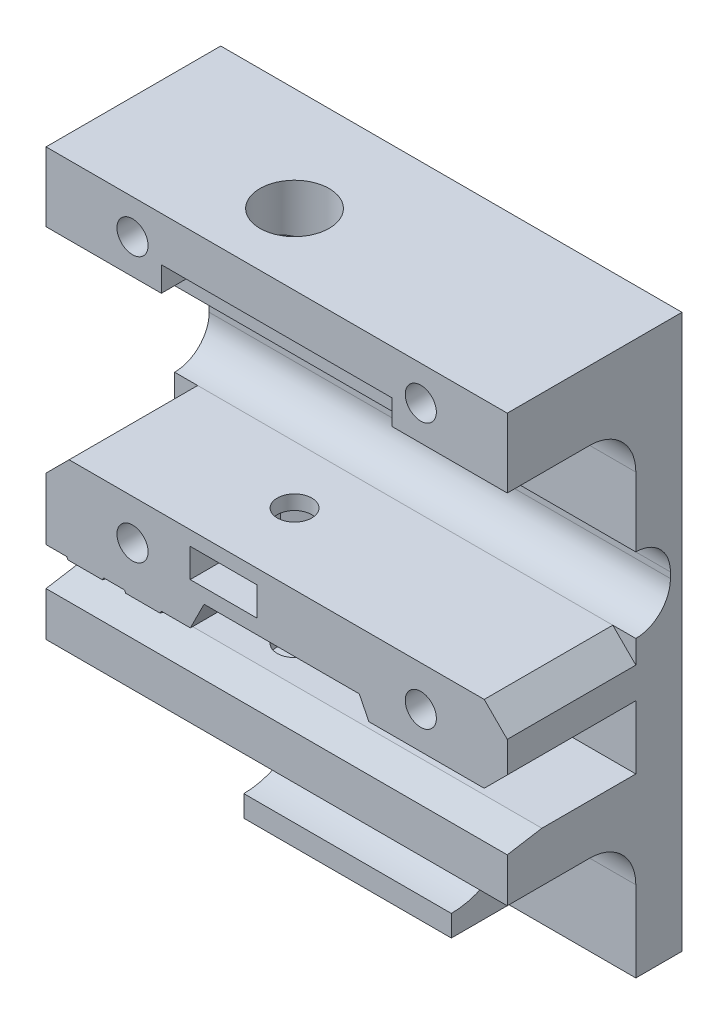
from build123d import *
from OCP.BRepFilletAPI import BRepFilletAPI_MakeChamfer

# Parameters (mm, degrees)
SKETCH1_W                = 40
SKETCH1_H                = 48
BOSS_EXTRUDE1_DEPTH      = 4
BOSS_EXTRUDE2_DEPTH      = 11.15
BOSS_EXTRUDE2_DEPTH_BACK = 4
SKETCH5_W                = 40
SKETCH5_H                = 4.325
SKETCH5_W_2              = 18
SKETCH5_H_2              = 5
SKETCH5_H_3              = 6
FILLET1_R                = 4
SKETCH6_R                = 1.35
CUT_EXTRUDE4_DEPTH       = 58.214705278
CHAMFER2_SIZE            = 2
SKETCH7_W                = 40
SKETCH7_H                = 6.5
CUT_EXTRUDE5_DEPTH       = 3
FILLET2_R                = 3
CHAMFER3_SIZE            = 3
CHAMFER3_SIZE2           = 1
CHAMFER4_SIZE            = 3
CHAMFER4_SIZE2           = 0.5
CUT_EXTRUDE6_DEPTH       = 10
CUT_EXTRUDE6_DEPTH_BACK  = 10
CUT_EXTRUDE8_REACH       = 66.292
SKETCH12_R               = 3
SKETCH13_R               = 1.5
CUT_EXTRUDE10_DEPTH      = 11.175
CUT_EXTRUDE7_DEPTH       = 1.25
CUT_EXTRUDE7_DEPTH_BACK  = 1.25


with BuildPart() as part:
    # Sketch1 → Boss-Extrude1 (new body)
    with BuildSketch(Plane.XY):
        with Locations((20, 14)):
            Rectangle(SKETCH1_W, SKETCH1_H)
    extrude(amount=BOSS_EXTRUDE1_DEPTH)

    # Sketch5 → Boss-Extrude2 (add, two sides: drawn at the far end of the back side and taken through both)
    with BuildSketch(Plane.XY.offset(4).offset(-BOSS_EXTRUDE2_DEPTH_BACK)):
        Polygon((1.8, 8.125), (0, 8.125), (0, 15.5), (40, 15.5), (40, 8.825), (28, 8.825), (27.1625, 10.5), (13.70350416, 10.5), (12.51600416, 8.125), (10, 8.125), (9.4, 6.925), (7.4, 6.925), (6.8, 8.125), (5, 8.125), (4.4, 6.925), (2.4, 6.925), align=None)
        with Locations((20, 3.1625)):
            Rectangle(SKETCH5_W, SKETCH5_H)
        with Locations((20, -7.5)):
            Rectangle(SKETCH5_W_2, SKETCH5_H_2)
        with Locations((20, 35)):
            Rectangle(SKETCH5_W, SKETCH5_H_3)
    extrude(amount=BOSS_EXTRUDE2_DEPTH + BOSS_EXTRUDE2_DEPTH_BACK)

    # Fillet1
    fillet1_edges = [part.edges().sort_by_distance(p)[0] for p in [
        (20, 32, 4),
        (20, 1, 4),
    ]]
    fillet(fillet1_edges, radius=FILLET1_R)

    # Sketch6 → Cut-Extrude4 (cut, through all)
    with BuildSketch(Plane.XY.offset(15.15)):
        with Locations((7.5, 35)):
            Circle(SKETCH6_R)
        with Locations((7.5, 12)):
            Circle(SKETCH6_R)
        with Locations((32.5, 35)):
            Circle(SKETCH6_R)
        with Locations((32.5, 12)):
            Circle(SKETCH6_R)
    extrude(amount=-CUT_EXTRUDE4_DEPTH, mode=Mode.SUBTRACT)

    # Chamfer2
    chamfer2_edges = [part.edges().sort_by_distance(p)[0] for p in [
        (40, 8.825, 9.575),
        (0, 15.5, 9.575),
        (40, 15.5, 9.575),
    ]]
    chamfer(chamfer2_edges, length=CHAMFER2_SIZE)

    # Sketch7 → Cut-Extrude5 (cut)
    with BuildSketch(Plane.XY.offset(4)):
        with Locations((20, 18.75)):
            Rectangle(SKETCH7_W, SKETCH7_H)
    extrude(amount=-CUT_EXTRUDE5_DEPTH, mode=Mode.SUBTRACT)

    # Fillet2
    fillet2_edges = [part.edges().sort_by_distance(p)[0] for p in [
        (20, 15.5, 1),
        (20, 22, 1),
    ]]
    fillet(fillet2_edges, radius=FILLET2_R - 0.0001)  # a hair under: the kernel refuses the full size

    # Chamfer3: one chamfer whose edges measure the first distance from different faces: ONE call of the kernel's chamfer builder (chamfer() names one face for all edges)
    chamfer3_edges_1 = [part.edges().sort_by_distance(p)[0] for p in [
        (3.4, 6.925, 15.15),
    ]]
    chamfer3_side_1 = [part.faces().sort_by_distance(p)[0] for p in [
        (3.4, 6.925, 9.575),
    ]]
    chamfer3_edges_2 = [part.edges().sort_by_distance(p)[0] for p in [
        (8.4, 6.925, 15.15),
    ]]
    chamfer3_side_2 = [part.faces().sort_by_distance(p)[0] for p in [
        (8.4, 6.925, 9.575),
    ]]
    chamfer3 = BRepFilletAPI_MakeChamfer(part.part.solid().wrapped)
    for e in chamfer3_edges_1:
        chamfer3.Add(CHAMFER3_SIZE, CHAMFER3_SIZE2, e.wrapped, chamfer3_side_1[0].wrapped)  # the first distance lies on this face
    for e in chamfer3_edges_2:
        chamfer3.Add(CHAMFER3_SIZE, CHAMFER3_SIZE2, e.wrapped, chamfer3_side_2[0].wrapped)  # the first distance lies on this face
    add(Compound.cast(chamfer3.Shape()), mode=Mode.REPLACE)

    # Chamfer4
    chamfer4_edges = [part.edges().sort_by_distance(p)[0] for p in [
        (20, 5.325, 15.15),
    ]]
    chamfer4_side = [part.faces().sort_by_distance(p)[0] for p in [
        (20, 5.325, 9.575),
    ]]
    chamfer(chamfer4_edges, length=CHAMFER4_SIZE, length2=CHAMFER4_SIZE2, reference=chamfer4_side[0])

    # Sketch8 → Cut-Extrude6 (cut, two sides: drawn at the far end of the back side and taken through both)
    with BuildSketch(Plane(origin=(20, 0, 0), x_dir=(0, 0, -1), z_dir=(1, 0, 0)).offset(-CUT_EXTRUDE6_DEPTH_BACK)):
        with BuildLine():
            Line((-9, 34.15), (-18.856272107, 34.15))
            Line((-18.856272107, 34.15), (-18.856272107, 21.85))
            Line((-18.856272107, 21.85), (-9, 21.85))
            ThreePointArc((-9, 21.85), (-2.85, 28), (-9, 34.15))
        make_face()
        with BuildLine():
            Line((-18.856272107, -10.437196649), (-18.856272107, -3.158858698))
            Line((-18.856272107, -3.158858698), (-13.348706704, 2.348706704))
            ThreePointArc((-13.348706704, 2.348706704), (-3.318140875, 0.353503109), (-9, -8.15))
            Line((-9, -8.15), (-9, -10.437196649))
            Line((-9, -10.437196649), (-18.856272107, -10.437196649))
        make_face()
    extrude(amount=CUT_EXTRUDE6_DEPTH + CUT_EXTRUDE6_DEPTH_BACK, mode=Mode.SUBTRACT)

    # Cut-Extrude8: up to this face of the body (flat: up to its plane)
    cut_extrude8_end = Plane(part.part.faces().sort_by_distance((20, 15.5, 9.574944444))[0])
    # Sketch12 → Cut-Extrude8 (cut, up to the picked face)
    with BuildSketch(Plane(origin=(0, 38, 0), x_dir=(1, 0, 0), z_dir=(0, 1, 0)), mode=Mode.PRIVATE) as cut_extrude8_sk1:
        with Locations(Location((15.4, -9, 0), (0, 0, 270))):
            Circle(SKETCH12_R)
    cut_extrude8_tool1 = split(extrude(cut_extrude8_sk1.sketch, amount=-CUT_EXTRUDE8_REACH, mode=Mode.PRIVATE), bisect_by=cut_extrude8_end, keep=Keep.BOTH, mode=Mode.PRIVATE)
    add(cut_extrude8_tool1.solids().sort_by(Axis((15.4, 38, 9), (0, -1, 0)))[0], mode=Mode.SUBTRACT)

    # Sketch13 → Cut-Extrude10 (cut)
    with BuildSketch(Plane(origin=(0, 15.5, 0), x_dir=(1, 0, 0), z_dir=(0, 1, 0))):
        with Locations(Location((15.4, -9, 0), (0, 0, 180))):
            Circle(SKETCH13_R)
    extrude(amount=-CUT_EXTRUDE10_DEPTH, mode=Mode.SUBTRACT)

    # Sketch9 → Cut-Extrude7 (cut, two sides: drawn at the far end of the back side and taken through both)
    with BuildSketch(Plane.XZ.offset(-13).offset(-CUT_EXTRUDE7_DEPTH_BACK)):
        Polygon((12.5, 16.815347994), (18.3, 16.815347994), (18.3, 7.325684219), (15.4, 5.651368439), (12.5, 7.325684219), align=None)
    extrude(amount=CUT_EXTRUDE7_DEPTH + CUT_EXTRUDE7_DEPTH_BACK, mode=Mode.SUBTRACT)


solid = part.part
